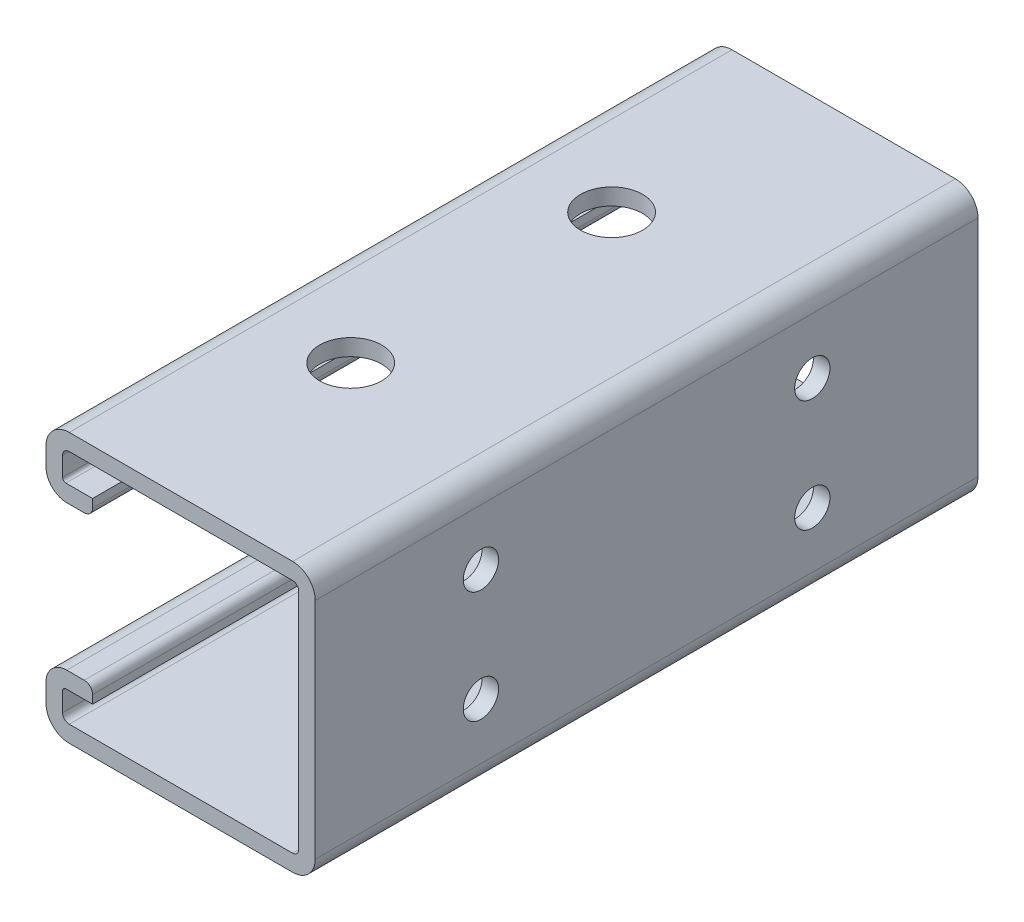
from build123d import *

# Parameters (mm, degrees)
BOSS_EXTRUDE1_DEPTH             = 50.8
BOSS_EXTRUDE1_DEPTH_BACK        = 50.8
SKETCH7_R                       = 4.7625
CUT_EXTRUDE1_DEPTH              = 45.72
TAP_DRILL_FOR_1_4_28_TAP2_D     = 5.4102
TAP_DRILL_FOR_1_4_28_TAP2_DEPTH = 2.54
TAP_DRILL_FOR_1_4_28_TAP2_TIP   = 1.625388061


with BuildPart() as part:
    # Sketch4 → Boss-Extrude1 (new, two sides: drawn at the far end of the back side and taken through both)
    with BuildSketch(Plane.XY.offset(-BOSS_EXTRUDE1_DEPTH_BACK)):
        with BuildLine():
            Line((-17.0815, -20.6375), (17.17675, -20.6375))
            ThreePointArc((17.17675, -20.6375), (19.623869793, -19.623869793), (20.6375, -17.17675))
            Line((20.6375, -17.17675), (20.6375, 17.17675))
            ThreePointArc((20.6375, 17.17675), (19.623869793, 19.623869793), (17.17675, 20.6375))
            Line((17.17675, 20.6375), (-17.0815, 20.6375))
            ThreePointArc((-17.0815, 20.6375), (-19.595971714, 19.595971714), (-20.6375, 17.0815))
            Line((-20.6375, 17.0815), (-20.6375, 14.2875))
            ThreePointArc((-20.6375, 14.2875), (-19.70756403, 12.04243597), (-17.4625, 11.1125))
            Line((-17.4625, 11.1125), (-14.7701, 11.1125))
            ThreePointArc((-14.7701, 11.1125), (-13.872074388, 11.484474388), (-13.5001, 12.3825))
            Line((-13.5001, 12.3825), (-13.5001, 13.6525))
            Line((-13.5001, 13.6525), (-17.5895, 13.6525))
            ThreePointArc((-17.5895, 13.6525), (-17.948710245, 13.801289755), (-18.0975, 14.1605))
            Line((-18.0975, 14.1605), (-18.0975, 17.0815))
            ThreePointArc((-18.0975, 17.0815), (-17.79992049, 17.79992049), (-17.0815, 18.0975))
            Line((-17.0815, 18.0975), (17.17675, 18.0975))
            ThreePointArc((17.17675, 18.0975), (17.827818569, 17.827818569), (18.0975, 17.17675))
            Line((18.0975, 17.17675), (18.0975, -17.17675))
            ThreePointArc((18.0975, -17.17675), (17.827818569, -17.827818569), (17.17675, -18.0975))
            Line((17.17675, -18.0975), (-17.0815, -18.0975))
            ThreePointArc((-17.0815, -18.0975), (-17.79992049, -17.79992049), (-18.0975, -17.0815))
            Line((-18.0975, -17.0815), (-18.0975, -14.1605))
            ThreePointArc((-18.0975, -14.1605), (-17.948710245, -13.801289755), (-17.5895, -13.6525))
            Line((-17.5895, -13.6525), (-13.5001, -13.6525))
            Line((-13.5001, -13.6525), (-13.5001, -12.3825))
            ThreePointArc((-13.5001, -12.3825), (-13.872074388, -11.484474388), (-14.7701, -11.1125))
            Line((-14.7701, -11.1125), (-17.4625, -11.1125))
            ThreePointArc((-17.4625, -11.1125), (-19.70756403, -12.04243597), (-20.6375, -14.2875))
            Line((-20.6375, -14.2875), (-20.6375, -17.0815))
            ThreePointArc((-20.6375, -17.0815), (-19.595971714, -19.595971714), (-17.0815, -20.6375))
        make_face()
    extrude(amount=BOSS_EXTRUDE1_DEPTH + BOSS_EXTRUDE1_DEPTH_BACK)

    # Sketch7 → Cut-Extrude1 (cut)
    with BuildSketch(Plane(origin=(0, 20.6375, 0), x_dir=(1, 0, 0), z_dir=(0, 1, 0))):
        with Locations((-4.73075, -20)):
            Circle(SKETCH7_R)
        with Locations((-4.73075, 20)):
            Circle(SKETCH7_R)
    extrude(amount=-CUT_EXTRUDE1_DEPTH, mode=Mode.SUBTRACT)

    # Tap Drill for 1/4-28 Tap2
    with Locations(Plane(origin=(20.6375, 0, 0), x_dir=(0, 0, -1), z_dir=(1, 0, 0))):
        with Locations((-25.4, 8.588375), (25.4, 8.588375), (25.4, -8.588375), (-25.4, -8.588375)):
            Hole(TAP_DRILL_FOR_1_4_28_TAP2_D / 2, depth=TAP_DRILL_FOR_1_4_28_TAP2_DEPTH)
            with Locations((0, 0, -(TAP_DRILL_FOR_1_4_28_TAP2_DEPTH + TAP_DRILL_FOR_1_4_28_TAP2_TIP / 2))):  # 118° drill point
                Cone(0, TAP_DRILL_FOR_1_4_28_TAP2_D / 2, TAP_DRILL_FOR_1_4_28_TAP2_TIP, mode=Mode.SUBTRACT)


solid = part.part
